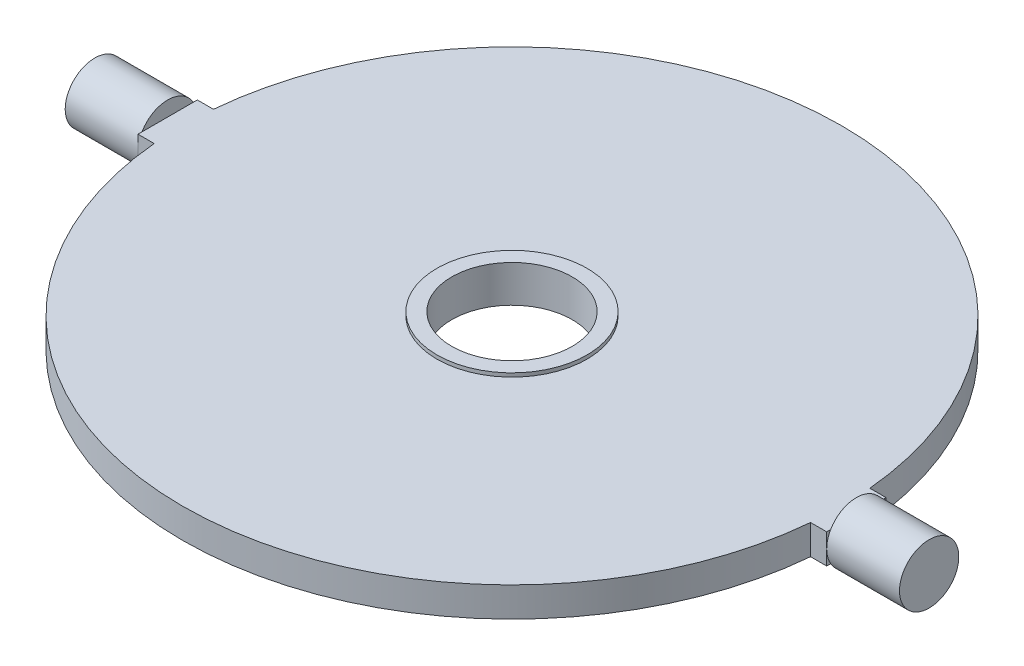
from build123d import *

# Parameters (mm, degrees)
SKETCH1_R           = 10.125
BOSS_EXTRUDE1_DEPTH = 2
SKETCH1_6_W         = 9.819656651
SKETCH1_6_H         = 4
SKETCH1_7_R         = 10.125
SKETCH1_7_R_2       = 8.125
BOSS_EXTRUDE2_DEPTH = 2.5


with BuildPart() as part:
    # Sketch1 → Boss-Extrude1 (new, symmetric)
    with BuildSketch(Plane(origin=(0, 0, 0), x_dir=(1, 0, 0), z_dir=(0, 1, 0))):
        with BuildLine():
            Line((-44.269656651, 4), (-46.45, 4))
            Line((-46.45, 4), (-46.45, -4))
            Line((-46.45, -4), (-44.269656651, -4))
            ThreePointArc((-44.269656651, -4), (0, -44.45), (44.269656651, -4))
            Line((44.269656651, -4), (46.45, -4))
            Line((46.45, -4), (46.45, 4))
            Line((46.45, 4), (44.269656651, 4))
            ThreePointArc((44.269656651, 4), (0, 44.45), (-44.269656651, 4))
        make_face()
        Circle(SKETCH1_R, mode=Mode.SUBTRACT)
    extrude(amount=BOSS_EXTRUDE1_DEPTH, both=True)

    # Sketch1<6> → Revolve1 (revolve)
    with BuildSketch(Plane(origin=(0, 0, 0), x_dir=(1, 0, 0), z_dir=(0, 1, 0))):
        with Locations((-51.359828326, -2)):
            Rectangle(SKETCH1_6_W, SKETCH1_6_H)
        with Locations((51.359828326, -2)):
            Rectangle(SKETCH1_6_W, SKETCH1_6_H)
    revolve(axis=Axis((-76.43543075, 0, 0), (1, 0, 0)))

    # Sketch1<7> → Boss-Extrude2 (add, symmetric)
    with BuildSketch(Plane(origin=(0, 0, 0), x_dir=(1, 0, 0), z_dir=(0, 1, 0))):
        Circle(SKETCH1_7_R)
        Circle(SKETCH1_7_R_2, mode=Mode.SUBTRACT)
    extrude(amount=BOSS_EXTRUDE2_DEPTH, both=True)


solid = part.part
